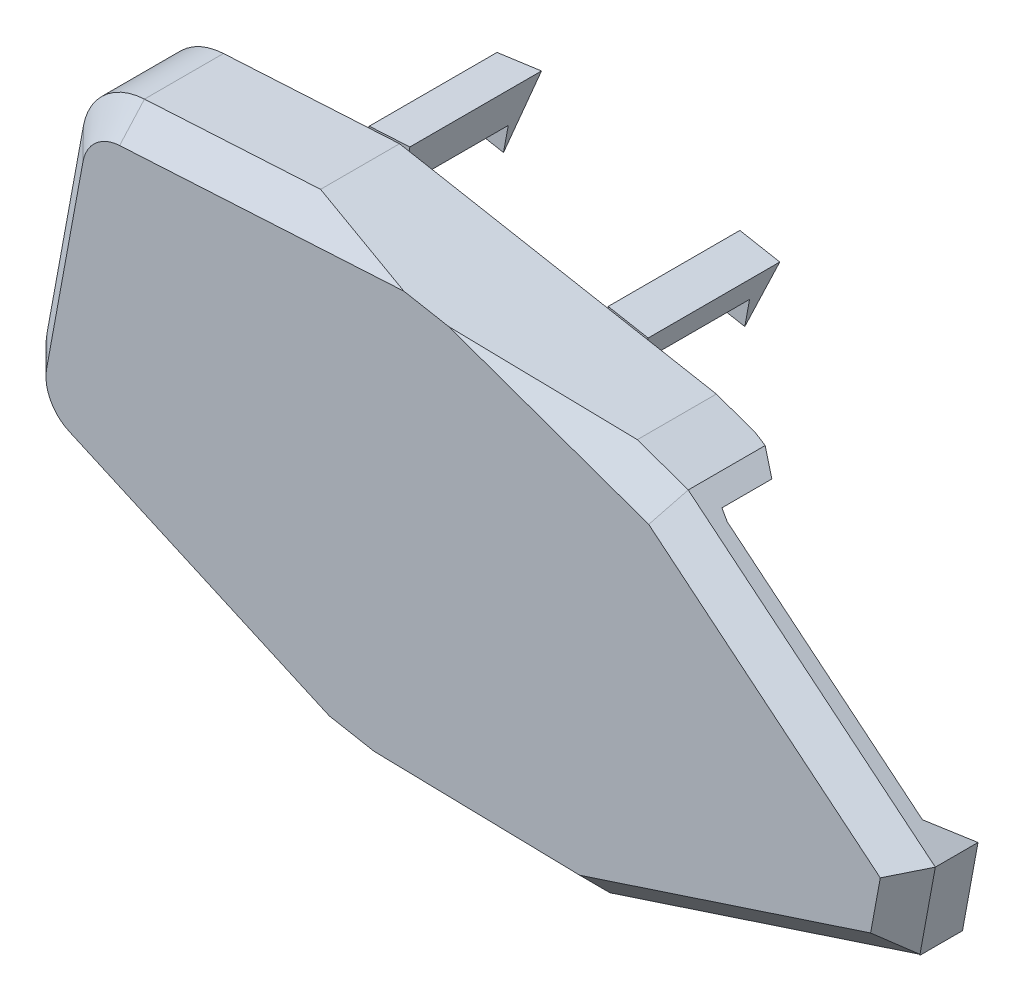
from build123d import *

# Parameters (mm, degrees)
BOSS_EXTRUDE1_DEPTH = 8
CUT_EXTRUDE1_DEPTH  = 5
CHAMFER1_SIZE       = 2
CHAMFER2_SIZE       = 2
BOSS_EXTRUDE2_DEPTH = 10
CHAMFER3_SIZE       = 5
CHAMFER5_SIZE       = 1
SKETCH4_W           = 3
SKETCH4_H           = 2
BOSS_EXTRUDE3_DEPTH = 2
CUT_EXTRUDE2_REACH  = 71.587
SKETCH8_W           = 3
SKETCH8_H           = 2
BOSS_EXTRUDE6_DEPTH = 2
SKETCH10_W          = 3.086016113
SKETCH10_H          = 2
BOSS_EXTRUDE7_DEPTH = 2
CUT_EXTRUDE6_REACH  = 65.526
CUT_EXTRUDE7_REACH  = 69.221
SKETCH14_W          = 3.086016113
SKETCH14_H          = 2
BOSS_EXTRUDE8_DEPTH = 2
CUT_EXTRUDE8_REACH  = 65.526
CUT_EXTRUDE9_DEPTH  = 10
CHAMFER6_SIZE       = 2


with BuildPart() as part:
    # Sketch1 → Boss-Extrude1 (new body)
    with BuildSketch(Plane.XY):
        with BuildLine():
            Line((-54.320190505, -28.24959399), (-51.558117567, -13.255731212))
            ThreePointArc((-51.558117567, -13.255731212), (-49.946755328, -10.410422216), (-46.921489424, -9.169439639))
            Line((-46.921489424, -9.169439639), (-33.546710063, -8.417567807))
            Line((-33.546710063, -8.417567807), (-9.484938073, -12.850072643))
            Line((-9.484938073, -12.850072643), (10.646906462, -20.027114874))
            ThreePointArc((10.646906462, -20.027114874), (13.299313006, -22.239005538), (13.885164949, -25.64260632))
            Line((13.885164949, -25.64260632), (11.241158147, -39.995549222))
            ThreePointArc((11.241158147, -39.995549222), (9.480940353, -42.966972131), (6.214468276, -44.088525055))
            Line((6.214468276, -44.088525055), (-15.153318385, -43.620772213))
            Line((-15.153318385, -43.620772213), (-39.215090375, -39.188267377))
            Line((-39.215090375, -39.188267377), (-51.444007577, -33.719847285))
            ThreePointArc((-51.444007577, -33.719847285), (-53.828484174, -31.482316748), (-54.320190505, -28.24959399))
        make_face()
    extrude(amount=BOSS_EXTRUDE1_DEPTH)

    # Sketch2 → Cut-Extrude1 (cut)
    with BuildSketch(Plane(origin=(0, 0, 0), x_dir=(-1, 0, 0), z_dir=(0, 0, -1))):
        with BuildLine():
            Line((53.057588595, -29.675312755), (49.84553587, -12.238742878))
            ThreePointArc((49.84553587, -12.238742878), (49.158345119, -11.064085999), (47.878630558, -10.601073521))
            Line((47.878630558, -10.601073521), (29.973319258, -10.601073521))
            Line((29.973319258, -10.601073521), (5.137929069, -15.176089324))
            Line((5.137929069, -15.176089324), (-10.10107167, -22.031458568))
            Line((-10.10107167, -22.031458568), (-10.675035013, -22.289659923))
            ThreePointArc((-10.675035013, -22.289659923), (-11.625784949, -23.184821715), (-11.821428067, -24.475931255))
            Line((-11.821428067, -24.475931255), (-8.921987001, -40.215494417))
            ThreePointArc((-8.921987001, -40.215494417), (-8.27911868, -41.352138774), (-7.071800124, -41.849755071))
            Line((-7.071800124, -41.849755071), (-6.443506549, -41.886484392))
            Line((-6.443506549, -41.886484392), (10.237987778, -42.861665394))
            Line((10.237987778, -42.861665394), (35.073377967, -38.286649591))
            Line((35.073377967, -38.286649591), (51.803353349, -31.906359903))
            ThreePointArc((51.803353349, -31.906359903), (52.834077643, -31.017733243), (53.057588595, -29.675312755))
        make_face()
    extrude(amount=-CUT_EXTRUDE1_DEPTH, mode=Mode.SUBTRACT)

    # Chamfer1
    chamfer1_edges = [part.edges().sort_by_distance(p)[0] for p in [
        (-4.469425054, -43.854648634, 8),
        (9.480940353, -42.966972131, 8),
        (12.563161548, -32.819077771, 8),
        (13.299313006, -22.239005538, 8),
        (0.580984195, -16.438593758, 8),
    ]]
    chamfer(chamfer1_edges, length=CHAMFER1_SIZE)

    # Chamfer2
    chamfer2_edges = [part.edges().sort_by_distance(p)[0] for p in [
        (-49.946755328, -10.410422216, 8),
        (-52.939154036, -20.752662601, 8),
        (-53.828484174, -31.482316748, 8),
        (-45.329548976, -36.454057331, 8),
        (-40.234099743, -8.793503723, 8),
    ]]
    chamfer(chamfer2_edges, length=CHAMFER2_SIZE)

    # Sketch3 → Boss-Extrude2 (add)
    with BuildSketch(Plane(origin=(0, 0, 0), x_dir=(-1, 0, 0), z_dir=(0, 0, -1))):
        Polygon((23.394716564, -42.102594861), (23.098142943, -40.492650345), (20.063192201, -41.051729445), (20.359765822, -42.661673961), align=None)
        Polygon((38.000366847, -36.653655449), (38.524189699, -39.49721829), (41.342508001, -38.236947396), (40.950724814, -36.110159485), align=None)
        Polygon((33.290068494, -11.083886396), (32.766245641, -8.240323555), (35.848643275, -8.413602522), (36.240426461, -10.540390432), align=None)
        Polygon((14.963133492, -13.366153375), (17.998084234, -12.807074275), (17.701510612, -11.197129759), (14.66655987, -11.756208859), align=None)
    extrude(amount=BOSS_EXTRUDE2_DEPTH)

    # Chamfer3
    # the kernel refuses this chamfer: 5 mm, written as the material it takes off along each edge
    with BuildSketch(Plane(origin=(-23.074487459, -43.612072424, 0), x_dir=(0.05833715256734155, -0.9979182097746037, -0.027495876610586372), z_dir=(0.998295648476819, 0.05835921720043501, 0))) as chamfer3_piece_1_section:
        Polygon((CHAMFER3_SIZE * 0.999621916911, -CHAMFER3_SIZE * 0.0274958766106), (-CHAMFER3_SIZE * 0.0274958766106, -CHAMFER3_SIZE * 0.999621916911), (0, 0), align=None)
    chamfer3_piece_1 = extrude(amount=30.197755173, mode=Mode.PRIVATE)
    chamfer3_piece_1 = split(chamfer3_piece_1, bisect_by=Plane(origin=(-2.089987913, -44.362637509, 2.130046666), z_dir=(0.18116532126255022, 0.9834526558873269, 0)), keep=Keep.TOP, mode=Mode.PRIVATE)
    add(chamfer3_piece_1, mode=Mode.SUBTRACT)
    with BuildSketch(Plane(origin=(6.95508169, -39.853163774, 0), x_dir=(0.9834526558873276, -0.18116532126254714, 0), z_dir=(0.18116532126254714, 0.9834526558873276, 0))) as chamfer3_piece_2:
        Polygon((2 + CHAMFER3_SIZE, 0), (2, -CHAMFER3_SIZE), (2, 0), align=None)
    revolve(axis=Axis((6.95508169, -39.853163774, 0), (0, 0, -1)), revolution_arc=76.216718402, mode=Mode.SUBTRACT)
    with BuildSketch(Plane(origin=(11.821428067, -24.475931255, 0), x_dir=(0.9830808290695956, -0.18109682571832125, -0.027495876610586386), z_dir=(-0.18116532126255008, -0.9834526558873269, 0))) as chamfer3_piece_3:
        Polygon((CHAMFER3_SIZE * 0.999621916911, CHAMFER3_SIZE * 0.0274958766106), (-CHAMFER3_SIZE * 0.0274958766106, CHAMFER3_SIZE * 0.999621916911), (0, 0), align=None)
    extrude(amount=16.004393366, mode=Mode.SUBTRACT)
    with BuildSketch(Plane(origin=(9.854522756, -24.113600612, 0), x_dir=(0.41025612875981127, 0.9119703442629113, 0), z_dir=(-0.9119703442629113, 0.41025612875981127, 0))) as chamfer3_piece_4:
        Polygon((2 + CHAMFER3_SIZE, 0), (2, -CHAMFER3_SIZE), (2, 0), align=None)
    revolve(axis=Axis((9.854522756, -24.113600612, 0), (0, 0, -1)), revolution_arc=76.216718402, mode=Mode.SUBTRACT)
    with BuildSketch(Plane(origin=(10.675035013, -22.289659923, 0), x_dir=(0.4101010178554897, 0.911625543698347, -0.02749587661058636), z_dir=(-0.9119703442629117, 0.41025612875981066, 0))) as chamfer3_piece_5_section:
        Polygon((CHAMFER3_SIZE * 0.999621916911, -CHAMFER3_SIZE * 0.0274958766106), (-CHAMFER3_SIZE * 0.0274958766106, -CHAMFER3_SIZE * 0.999621916911), (0, 0), align=None)
    chamfer3_piece_5 = extrude(amount=30.197755173, mode=Mode.PRIVATE)
    chamfer3_piece_5 = split(chamfer3_piece_5, bisect_by=Plane(origin=(3.019797747, -16.678853276, 2.155995237), z_dir=(-0.18116532126254994, -0.983452655887327, 0)), keep=Keep.TOP, mode=Mode.PRIVATE)
    add(chamfer3_piece_5, mode=Mode.SUBTRACT)

    # Chamfer5
    # the kernel refuses this chamfer: 1 mm, written as the material it takes off along each edge
    with BuildSketch(Plane(origin=(-23.098142943, -40.492650345, 0), x_dir=(0.004981299321445123, 0.02704089288890644, 0.9996219169110092), z_dir=(-0.9834526558873269, 0.18116532126255022, 0))) as chamfer5_piece_1_section:
        Polygon((CHAMFER5_SIZE * 0.999621916911, -CHAMFER5_SIZE * 0.0274958766104), (-CHAMFER5_SIZE * 0.027495876621, -CHAMFER5_SIZE * 0.999621916911), (0, 0), align=None)
    chamfer5_piece_1 = extrude(amount=14.748410513, mode=Mode.PRIVATE)
    chamfer5_piece_1 = split(chamfer5_piece_1, bisect_by=Plane(origin=(-28.668481956, -40.729276734, 0.347878309), z_dir=(0.35633503270067046, 0.9343582527436745, 0)), keep=Keep.TOP, mode=Mode.PRIVATE)
    add(chamfer5_piece_1, mode=Mode.SUBTRACT)
    with BuildSketch(Plane(origin=(-38.218434546, -37.087223316, 0), x_dir=(-0.3562003084508938, -0.9340049876895217, -0.02749587661058614), z_dir=(-0.9343582527436745, 0.35633503270067046, 0))) as chamfer5_piece_2_section:
        Polygon((CHAMFER5_SIZE * 0.999621916911, CHAMFER5_SIZE * 0.0274958766106), (-CHAMFER5_SIZE * 0.0274958766106, CHAMFER5_SIZE * 0.999621916911), (0, 0), align=None)
    chamfer5_piece_2 = extrude(amount=14.53930413, mode=Mode.PRIVATE)
    chamfer5_piece_2 = split(chamfer5_piece_2, bisect_by=Plane(origin=(-40.84035239, -36.130491583, 0.489990554), z_dir=(0.18116532126254972, 0.983452655887327, 0)), keep=Keep.TOP, mode=Mode.PRIVATE)
    add(chamfer5_piece_2, mode=Mode.SUBTRACT)
    with BuildSketch(Plane(origin=(-38.218434546, -37.087223316, 0), x_dir=(-0.3562003084508938, -0.9340049876895217, -0.02749587661058614), z_dir=(-0.9343582527436745, 0.35633503270067046, 0))) as chamfer5_piece_3_section:
        Polygon((CHAMFER5_SIZE * 0.999621916911, CHAMFER5_SIZE * 0.0274958766106), (-CHAMFER5_SIZE * 0.0274958766106, CHAMFER5_SIZE * 0.999621916911), (0, 0), align=None)
    chamfer5_piece_3 = extrude(amount=14.53930413, mode=Mode.PRIVATE)
    chamfer5_piece_3 = split(chamfer5_piece_3, bisect_by=Plane(origin=(-40.993983544, -36.344988713, 0.234829228), z_dir=(-0.9834526558873267, 0.18116532126255175, 0)), keep=Keep.TOP, mode=Mode.PRIVATE)
    add(chamfer5_piece_3, mode=Mode.SUBTRACT)
    with BuildSketch(Plane(origin=(1.897012872, -16.472021069, 0), x_dir=(-0.004981299319533664, -0.02704089287863599, 0.9996219169112968), z_dir=(-0.9834526558873531, 0.18116532126240795, 1.5207756333546186e-14))) as chamfer5_piece_4:
        Polygon((CHAMFER5_SIZE * 0.999621916911, CHAMFER5_SIZE * 0.0274958766106), (-CHAMFER5_SIZE * 0.0274958766106, CHAMFER5_SIZE * 0.999621916911), (0, 0), align=None)
    extrude(amount=17.143831239, mode=Mode.SUBTRACT)
    with BuildSketch(Plane(origin=(-32.502447723, -10.135173746, 0), x_dir=(-0.00498129931955216, -0.02704089287863057, 0.9996219169112968), z_dir=(0.983452655887327, -0.18116532126254994, 0))) as chamfer5_piece_5_section:
        Polygon((CHAMFER5_SIZE * 0.999621916911, -CHAMFER5_SIZE * 0.0274958766106), (-CHAMFER5_SIZE * 0.0274958766106, -CHAMFER5_SIZE * 0.999621916911), (0, 0), align=None)
    chamfer5_piece_5 = extrude(amount=14.748410513, mode=Mode.PRIVATE)
    chamfer5_piece_5 = split(chamfer5_piece_5, bisect_by=Plane(origin=(-23.118458189, -10.601073521, 0.347878309), z_dir=(0, -1, 0)), keep=Keep.TOP, mode=Mode.PRIVATE)
    add(chamfer5_piece_5, mode=Mode.SUBTRACT)
    with BuildSketch(Plane(origin=(-20.063192201, -41.051729445, 0), x_dir=(0.004981299321182515, 0.027040892887405597, 0.9996219169110512), z_dir=(0.9834526558873424, -0.18116532126246593, -1.60020737234311e-14))) as chamfer5_piece_6:
        Polygon((CHAMFER5_SIZE * 0.999621916911, CHAMFER5_SIZE * 0.0274958766105), (-CHAMFER5_SIZE * 0.0274958766195, CHAMFER5_SIZE * 0.999621916911), (0, 0), align=None)
    extrude(amount=17.991435412, mode=Mode.SUBTRACT)
    with BuildSketch(Plane(origin=(-51.090683283, -30.037643398, 0), x_dir=(-0.35633503270066896, -0.934358252743675, 0), z_dir=(0.934358252743675, -0.35633503270066896, 0))) as chamfer5_piece_7:
        Polygon((2 + CHAMFER5_SIZE, 0), (2, -CHAMFER5_SIZE), (2, 0), align=None)
    revolve(axis=Axis((-51.090683283, -30.037643398, 0), (0, 0, -1)), revolution_arc=79.562356174, mode=Mode.SUBTRACT)
    with BuildSketch(Plane(origin=(-53.057588595, -29.675312755, 0), x_dir=(-0.9830808290695958, 0.18109682571832017, -0.027495876610586695), z_dir=(0.18116532126254906, 0.9834526558873271, 0))) as chamfer5_piece_8:
        Polygon((CHAMFER5_SIZE * 0.999621916911, CHAMFER5_SIZE * 0.0274958766106), (-CHAMFER5_SIZE * 0.0274958766106, CHAMFER5_SIZE * 0.999621916911), (0, 0), align=None)
    extrude(amount=17.729953519, mode=Mode.SUBTRACT)
    with BuildSketch(Plane(origin=(-47.878630558, -12.601073521, 0), x_dir=(-0.983452655887328, 0.1811653212625444, 0), z_dir=(-0.1811653212625444, -0.983452655887328, 0))) as chamfer5_piece_9:
        Polygon((2 + CHAMFER5_SIZE, 0), (2, -CHAMFER5_SIZE), (2, 0), align=None)
    revolve(axis=Axis((-47.878630558, -12.601073521, 0), (0, 0, -1)), revolution_arc=79.562356174, mode=Mode.SUBTRACT)
    with BuildSketch(Plane(origin=(-47.878630558, -10.601073521, 0), x_dir=(0, 0.9996219169112968, -0.02749587661058632), z_dir=(1, 0, 0))) as chamfer5_piece_10_section:
        Polygon((CHAMFER5_SIZE * 0.999621916911, CHAMFER5_SIZE * 0.0274958766106), (-CHAMFER5_SIZE * 0.0274958766106, CHAMFER5_SIZE * 0.999621916911), (0, 0), align=None)
    chamfer5_piece_10 = extrude(amount=14.53930413, mode=Mode.PRIVATE)
    chamfer5_piece_10 = split(chamfer5_piece_10, bisect_by=Plane(origin=(-42.562463458, -9.375785449, 0.347894449), z_dir=(-0.18116532126254817, -0.9834526558873274, 0)), keep=Keep.TOP, mode=Mode.PRIVATE)
    add(chamfer5_piece_10, mode=Mode.SUBTRACT)
    with BuildSketch(Plane(origin=(-47.878630558, -10.601073521, 0), x_dir=(0, 0.9996219169112968, -0.02749587661058632), z_dir=(1, 0, 0))) as chamfer5_piece_11_section:
        Polygon((CHAMFER5_SIZE * 0.999621916911, CHAMFER5_SIZE * 0.0274958766106), (-CHAMFER5_SIZE * 0.0274958766106, CHAMFER5_SIZE * 0.999621916911), (0, 0), align=None)
    chamfer5_piece_11 = extrude(amount=14.53930413, mode=Mode.PRIVATE)
    chamfer5_piece_11 = split(chamfer5_piece_11, bisect_by=Plane(origin=(-36.197167732, -10.305561204, 0.234829228), z_dir=(-0.9834526558873272, 0.1811653212625484, 0)), keep=Keep.TOP, mode=Mode.PRIVATE)
    add(chamfer5_piece_11, mode=Mode.SUBTRACT)

    # Sketch4 → Boss-Extrude3 (add)
    with BuildSketch(Plane(origin=(-7.777695995, -42.221081437, 0), x_dir=(0.9834526558873268, -0.18116532126255072, 0), z_dir=(0.18116532126255072, 0.9834526558873268, 0))):
        with Locations((-32.231190435, 9)):
            Rectangle(SKETCH4_W, SKETCH4_H)
    extrude(amount=BOSS_EXTRUDE3_DEPTH)

    # Sketch5 → Cut-Extrude2 (cut, up to next)
    with BuildSketch(Plane(origin=(-33.17302882, 6.110921952, 0), x_dir=(0, 0, 1), z_dir=(-0.9834526558873264, 0.18116532126255258, 0)), mode=Mode.PRIVATE) as cut_extrude2_sk1:
        Polygon((-8, -40.931483467), (-10, -45.094056213), (-10, -40.931483467), align=None)
    cut_extrude2_tool1 = extrude(cut_extrude2_sk1.sketch, amount=-CUT_EXTRUDE2_REACH, mode=Mode.PRIVATE) & part.part
    add(cut_extrude2_tool1.solids().sort_by_distance((-40.839765, -35.507819, -9.333333))[0], mode=Mode.SUBTRACT)

    # Sketch8 → Boss-Extrude6 (add)
    with BuildSketch(Plane(origin=(-3.067397642, -16.651312384, 0), x_dir=(0.9834526558873273, -0.1811653212625481, 0), z_dir=(-0.1811653212625481, -0.9834526558873273, 0))):
        with Locations((-32.231190435, -9)):
            Rectangle(SKETCH8_W, SKETCH8_H)
    extrude(amount=BOSS_EXTRUDE6_DEPTH)

    # Sketch10 → Boss-Extrude7 (add)
    with BuildSketch(Plane(origin=(-2.872517463, -15.593408876, 0), x_dir=(0.983452655887327, -0.18116532126255, 0), z_dir=(-0.18116532126255, -0.983452655887327, 0))):
        with Locations((-13.837057959, -9)):
            Rectangle(SKETCH10_W, SKETCH10_H)
    extrude(amount=BOSS_EXTRUDE7_DEPTH)

    # Sketch12 → Cut-Extrude6 (cut, up to next)
    with BuildSketch(Plane(origin=(-12.090616028, 2.2272555, 0), x_dir=(0, 0, -1), z_dir=(0.9834526558873278, -0.18116532126254553, 0)), mode=Mode.PRIVATE) as cut_extrude6_sk1:
        Polygon((8, -17.855779922), (10, -14.218746856), (10, -17.855779922), align=None)
    cut_extrude6_tool1 = extrude(cut_extrude6_sk1.sketch, amount=-CUT_EXTRUDE6_REACH, mode=Mode.PRIVATE) & part.part
    add(cut_extrude6_tool1.solids().sort_by_distance((-15.105829, -14.140775, -9.333333))[0], mode=Mode.SUBTRACT)

    # Sketch13 → Cut-Extrude7 (cut, up to next)
    with BuildSketch(Plane(origin=(-30.222670852, 5.567425988, 0), x_dir=(0, 0, -1), z_dir=(0.9834526558873274, -0.18116532126254756, 0)), mode=Mode.PRIVATE) as cut_extrude7_sk1:
        Polygon((8, -18.931483467), (10, -14.040075503), (10, -18.931483467), align=None)
    cut_extrude7_tool1 = extrude(cut_extrude7_sk1.sketch, amount=-CUT_EXTRUDE7_REACH, mode=Mode.PRIVATE) & part.part
    add(cut_extrude7_tool1.solids().sort_by_distance((-33.357015, -11.447302, -9.333333))[0], mode=Mode.SUBTRACT)

    # Sketch14 → Boss-Extrude8 (add)
    with BuildSketch(Plane(origin=(-7.972576173, -43.278984945, 0), x_dir=(0.9834526558873271, -0.18116532126254975, 0), z_dir=(0.18116532126254975, 0.9834526558873271, 0))):
        with Locations((-13.837057959, 9)):
            Rectangle(SKETCH14_W, SKETCH14_H)
    extrude(amount=BOSS_EXTRUDE8_DEPTH)

    # Sketch15 → Cut-Extrude8 (cut, up to next)
    with BuildSketch(Plane(origin=(-12.090616028, 2.2272555, 0), x_dir=(0, 0, -1), z_dir=(0.9834526558873269, -0.18116532126255053, 0)), mode=Mode.PRIVATE) as cut_extrude8_sk1:
        Polygon((8, -42.007187012), (10, -45.644220078), (10, -42.007187012), align=None)
    cut_extrude8_tool1 = extrude(cut_extrude8_sk1.sketch, amount=-CUT_EXTRUDE8_REACH, mode=Mode.PRIVATE) & part.part
    add(cut_extrude8_tool1.solids().sort_by_distance((-19.920496, -40.277107, -9.333333))[0], mode=Mode.SUBTRACT)

    # Sketch17 → Cut-Extrude9 (cut)
    with BuildSketch(Plane.XY.offset(8)):
        Polygon((13.146341231, -29.653297454), (-7.687958424, -12.528604727), (18.211690395, -20.597072459), align=None)
        Polygon((-13.66636111, -44.387279773), (13.396428243, -46.257416903), (11.958940519, -35.980909599), align=None)
    extrude(amount=-CUT_EXTRUDE9_DEPTH, mode=Mode.SUBTRACT)

    # Chamfer6
    chamfer6_edges = [part.edges().sort_by_distance(p)[0] for p in [
        (5.160529327, -23.08938231, 8),
        (1.9826537, -39.253626587, 8),
    ]]
    chamfer(chamfer6_edges, length=CHAMFER6_SIZE)


solid = part.part
